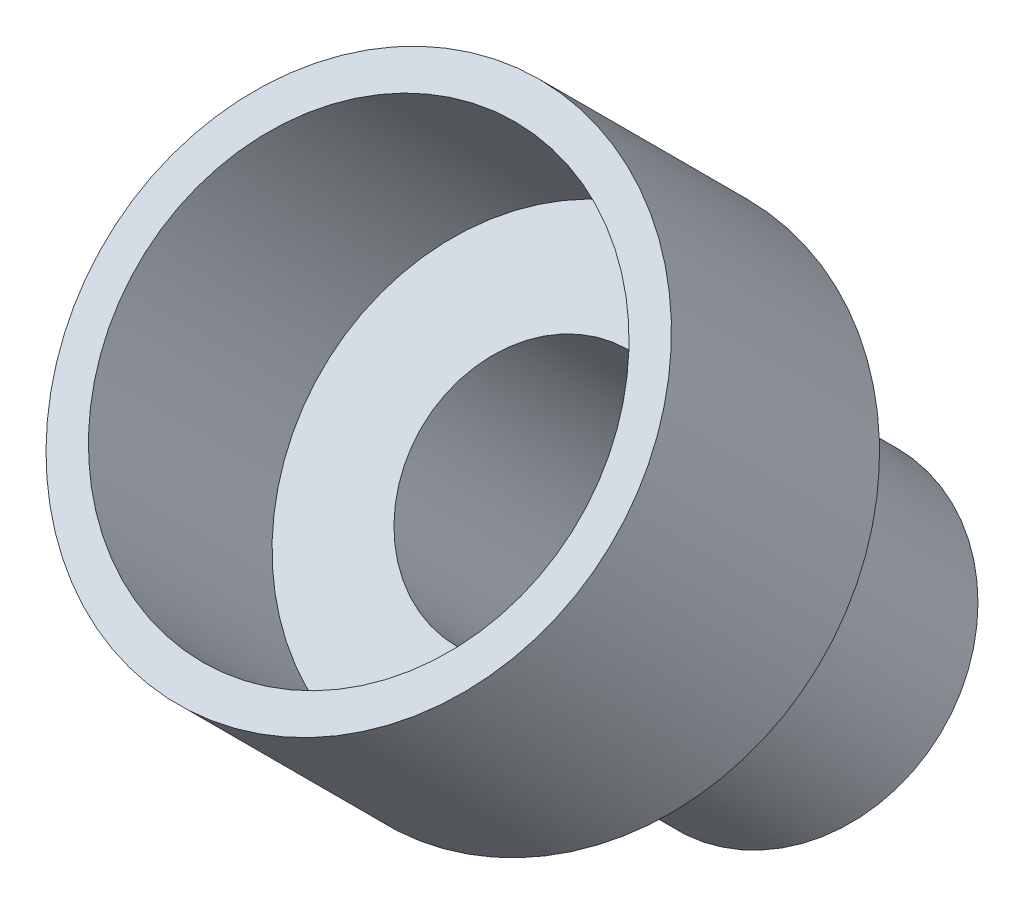
from build123d import *

# Parameters (mm, degrees)
CIRPATTERN1_COUNT = 2
CIRPATTERN1_ANGLE = 90


with BuildPart() as part:
    # Sketch1 → Revolve1 (revolve)
    with BuildSketch(Plane(origin=(0, 0, 0), x_dir=(0, 0, -1), z_dir=(1, 0, 0))):
        Polygon((-51.442018331, 125.566457335), (-40.835416614, 114.959855617), (-36.769552622, 119.025719609), (-22.627416998, 104.883583986), (-24.04163056, 103.469370423), (-36.769552622, 116.197292485), (-40.835416614, 112.131428493), (-52.856231894, 124.152243773), align=None)
    revolve1 = revolve(axis=Axis((0, 92.155661924, 0), (0, 0.7071067811865461, 0.707106781186549)))

    # CirPattern1: Revolve1 ×2 about axis
    cirpattern1_axis = Axis((0, 46.077830962, -46.077830962), (0, 0.707106781, 0.707106781))
    for i in range(1, CIRPATTERN1_COUNT):
        add(revolve1.rotate(cirpattern1_axis, i * CIRPATTERN1_ANGLE / (CIRPATTERN1_COUNT - 1)))


solid = part.part
